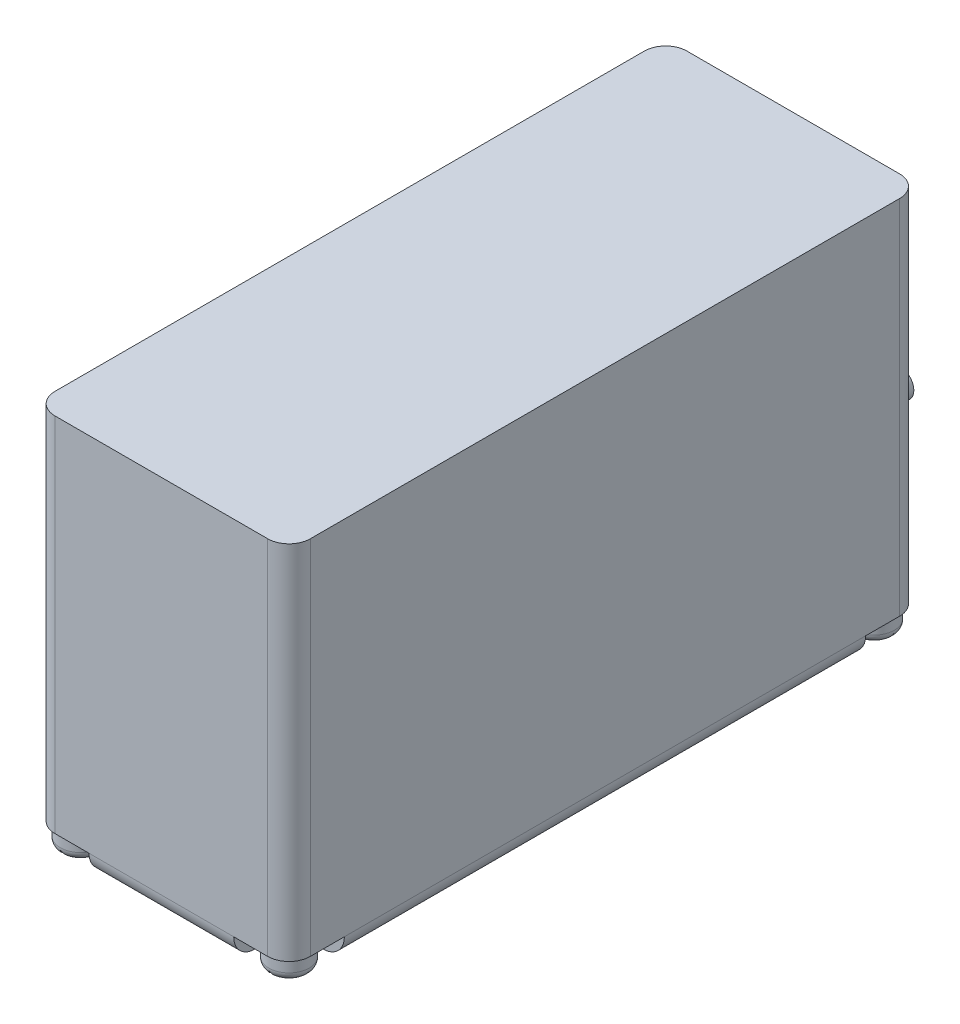
from build123d import *

# Parameters (mm, degrees)
SKETCH1_W            = 12
SKETCH1_H            = 29.7
BOSS_EXTRUDE1_DEPTH  = 18
CUT_EXTRUDE1_DEPTH   = 1
SKETCH3_R            = 0.95
BOSS_EXTRUDE2_DEPTH  = 1
FILLET1_R            = 0.4
CUT_EXTRUDE2_START   = 3.9499999
CUT_EXTRUDE2_DEPTH   = 1.9000002
CUT_EXTRUDE2_START_2 = -14.675049783
CUT_EXTRUDE2_2_DEPTH = 1.850099512
CUT_EXTRUDE2_START_3 = 4.868090347
CUT_EXTRUDE2_3_DEPTH = 0.063817292
FILLET2_R            = 1
BOSS_EXTRUDE3_DEPTH  = 0.2
SKETCH6_R            = 0.65
SKETCH7_R            = 1.2
CUT_EXTRUDE3_DEPTH   = 0.4
BOSS_EXTRUDE4_DEPTH  = 0.1
SKETCH10_R           = 2.9
CUT_EXTRUDE4_DEPTH   = 0.05
BOSS_EXTRUDE5_DEPTH  = 0.05
CHAMFER1_SIZE        = 0.05


with BuildPart() as part:
    # Sketch1 → Boss-Extrude1 (new body)
    with BuildSketch(Plane(origin=(0, 0, 0), x_dir=(1, 0, 0), z_dir=(0, 1, 0))):
        Rectangle(SKETCH1_W, SKETCH1_H)
    extrude(amount=BOSS_EXTRUDE1_DEPTH)

    # Sketch2 → Cut-Extrude1 (cut)
    with BuildSketch(Plane.XZ):
        with BuildLine():
            Line((6, -14.85), (3.4, -14.85))
            Line((3.4, -14.85), (3.4, -13.75))
            ThreePointArc((3.4, -13.75), (3.839339828, -12.689339828), (4.9, -12.25))
            Line((4.9, -12.25), (6, -12.25))
            Line((6, -12.25), (6, -14.85))
        make_face()
    extrude(amount=-CUT_EXTRUDE1_DEPTH, mode=Mode.SUBTRACT)

    # Sketch3 → Boss-Extrude2 (add)
    with BuildSketch(Plane.XZ.offset(-1)):
        with Locations(Location((4.9, -13.75, 0), (0, 0, 90))):
            Circle(SKETCH3_R)
    extrude(amount=BOSS_EXTRUDE2_DEPTH)

    # Fillet1
    fillet1_edges = [part.edges().sort_by_distance(p)[0] for p in [
        (4.9, 0, -14.7),
    ]]
    fillet(fillet1_edges, radius=FILLET1_R)

    # Cut-Extrude2: read off the stored shape, not the designer's step
    # Cut-Extrude2 outline → Cut-Extrude2 (cut)
    with BuildSketch(Plane.YZ.offset(CUT_EXTRUDE2_START)):
        Polygon((0, -13.655392241), (0, -13.844607759), (0.259932682, -13.75), align=None)
    extrude(amount=CUT_EXTRUDE2_DEPTH, mode=Mode.SUBTRACT)

    # Cut-Extrude2 2 outline → Cut-Extrude2 2 (cut)
    with BuildSketch(Plane.XY.offset(CUT_EXTRUDE2_START_2)):
        Polygon((4.772574698, 0), (5.027425302, 0), (4.9, 0.350098139), align=None)
    extrude(amount=CUT_EXTRUDE2_2_DEPTH, mode=Mode.SUBTRACT)

    # Cut-Extrude2 3 outline → Cut-Extrude2 3 (add)
    with BuildSketch(Plane.YZ.offset(CUT_EXTRUDE2_START_3)):
        Polygon((0.350098139, -14.643141941), (0.262432064, -14.675049783), (2, -14.675049783), (2, -14.04262677), align=None)
        Polygon((0.350098139, -12.856858059), (2, -13.457373235), (2, -12.824950271), (0.262432213, -12.824950271), align=None)
    extrude(amount=CUT_EXTRUDE2_3_DEPTH)

    # Mirror1: read off the stored shape, not the designer's step
    # Mirror1
    split(bisect_by=Plane(origin=(0, 0, 0), x_dir=(0, 0, 1), z_dir=(1, 0, 0)), keep=Keep.TOP)

    # Mirror1 2: part across plane


with BuildPart() as part_1:
    add(part.part)
    add(part.part.mirror(Plane(origin=(0, 0, 0), x_dir=(0, 0, 1), z_dir=(1, 0, 0))))

    # Mirror4: read off the stored shape, not the designer's step
    # Mirror4
    split(bisect_by=Plane.XY, keep=Keep.BOTTOM)

    # Mirror4 2: part across plane


with BuildPart() as part_2:
    add(part_1.part)
    add(part_1.part.mirror(Plane.XY))

    # Fillet2
    fillet2_edges = [part_2.edges().sort_by_distance(p)[0] for p in [
        (0, 0, -14.85),
        (6, 0, 0),
        (0, 0, 14.85),
        (-6, 0, 0),
        (-6, 9.5, 14.85),
        (6, 9.5, 14.85),
        (6, 9.5, -14.85),
        (-6, 9.5, -14.85),
    ]]
    fillet(fillet2_edges, radius=FILLET2_R)

    # Sketch5 → Boss-Extrude3 (add)
    with BuildSketch(Plane(origin=(0, 0, -14.85), x_dir=(-1, 0, 0), z_dir=(0, 0, -1))):
        with BuildLine():
            Line((-2, 7), (2, 7))
            ThreePointArc((2, 7), (2.282842712, 6.882842712), (2.4, 6.6))
            Line((2.4, 6.6), (2.4, 5.2))
            Line((2.4, 5.2), (1.96, 5.2))
            Line((1.96, 5.2), (1.96, 6.3))
            ThreePointArc((1.96, 6.3), (1.901421356, 6.441421356), (1.76, 6.5))
            Line((1.76, 6.5), (-1.76, 6.5))
            ThreePointArc((-1.76, 6.5), (-1.901421356, 6.441421356), (-1.96, 6.3))
            Line((-1.96, 6.3), (-1.96, 5.2))
            Line((-1.96, 5.2), (-2.4, 5.2))
            Line((-2.4, 5.2), (-2.4, 6.6))
            ThreePointArc((-2.4, 6.6), (-2.282842712, 6.882842712), (-2, 7))
        make_face()
    extrude(amount=BOSS_EXTRUDE3_DEPTH)

    # Sketch7 → Cut-Extrude3 (cut)
    with BuildSketch(Plane.XZ):
        with Locations(Location((0, 0, 0), (0, 0, 270))):
            Circle(SKETCH7_R)
    extrude(amount=-CUT_EXTRUDE3_DEPTH, mode=Mode.SUBTRACT)

    # Sketch9 → Boss-Extrude4 (add)
    with BuildSketch(Plane.XZ):
        with BuildLine():
            Line((-2, -8.35), (-1.5, -8.35))
            ThreePointArc((-1.5, -8.35), (-1.145643924, -7.381754163), (-0.25, -6.870980054))
            Line((-0.25, -6.870980054), (-0.25, -8.35))
            Line((-0.25, -8.35), (0.25, -8.35))
            Line((0.25, -8.35), (0.25, -6.870980054))
            ThreePointArc((0.25, -6.870980054), (1.145643924, -7.381754163), (1.5, -8.35))
            Line((1.5, -8.35), (2, -8.35))
            ThreePointArc((2, -8.35), (0, -6.35), (-2, -8.35))
        make_face()
        with BuildLine():
            Line((-2, -5.35), (-1.5, -5.35))
            ThreePointArc((-1.5, -5.35), (0, -3.85), (1.5, -5.35))
            Line((1.5, -5.35), (2, -5.35))
            ThreePointArc((2, -5.35), (0, -3.35), (-2, -5.35))
        make_face()
    extrude(amount=BOSS_EXTRUDE4_DEPTH)

    # Sketch10 → Cut-Extrude4 (cut)
    with BuildSketch(Plane.XZ):
        with Locations(Location((0, 8.85, 0), (0, 0, 270))):
            Circle(SKETCH10_R)
    extrude(amount=-CUT_EXTRUDE4_DEPTH, mode=Mode.SUBTRACT)

    # Sketch11 → Boss-Extrude5 (add)
    with BuildSketch(Plane(origin=(0, 0, -14.85), x_dir=(-1, 0, 0), z_dir=(0, 0, -1))):
        Polygon((-2.4, 5.2), (-2.4, 1), (-1.9, 1), (-1.9, 4.7), (1.9, 4.7), (1.9, 1), (2.4, 1), (2.4, 5.2), align=None)
    extrude(amount=BOSS_EXTRUDE5_DEPTH)

    # Chamfer1
    chamfer1_edges = [part_2.edges().sort_by_distance(p)[0] for p in [
        (-2.15, 1, -14.9),
        (2.15, 1, -14.9),
    ]]
    chamfer(chamfer1_edges, length=CHAMFER1_SIZE - 0.0001)  # a hair under: the kernel refuses the full size


with BuildPart() as body_2:
    # Sweep1: sweep along a curve in space
    with BuildLine() as sweep1_path:
        Line((-1.31, 5.816180381, -15.05), (-1.31, 5.816180381, -18.553603561))
    # Sketch6 → Sweep1 (sweep)
    with BuildSketch(Plane(origin=(0, 0, -15.05), x_dir=(-1, 0, 0), z_dir=(0, 0, -1))):
        with Locations((-1.31, 5.816180381)):
            Circle(SKETCH6_R)
        with Locations((0, 5.816180381)):
            Circle(SKETCH6_R)
        with Locations((1.31, 5.816180381)):
            Circle(SKETCH6_R)
    sweep(path=sweep1_path.line)


solid = Compound([part_2.part, body_2.part])
